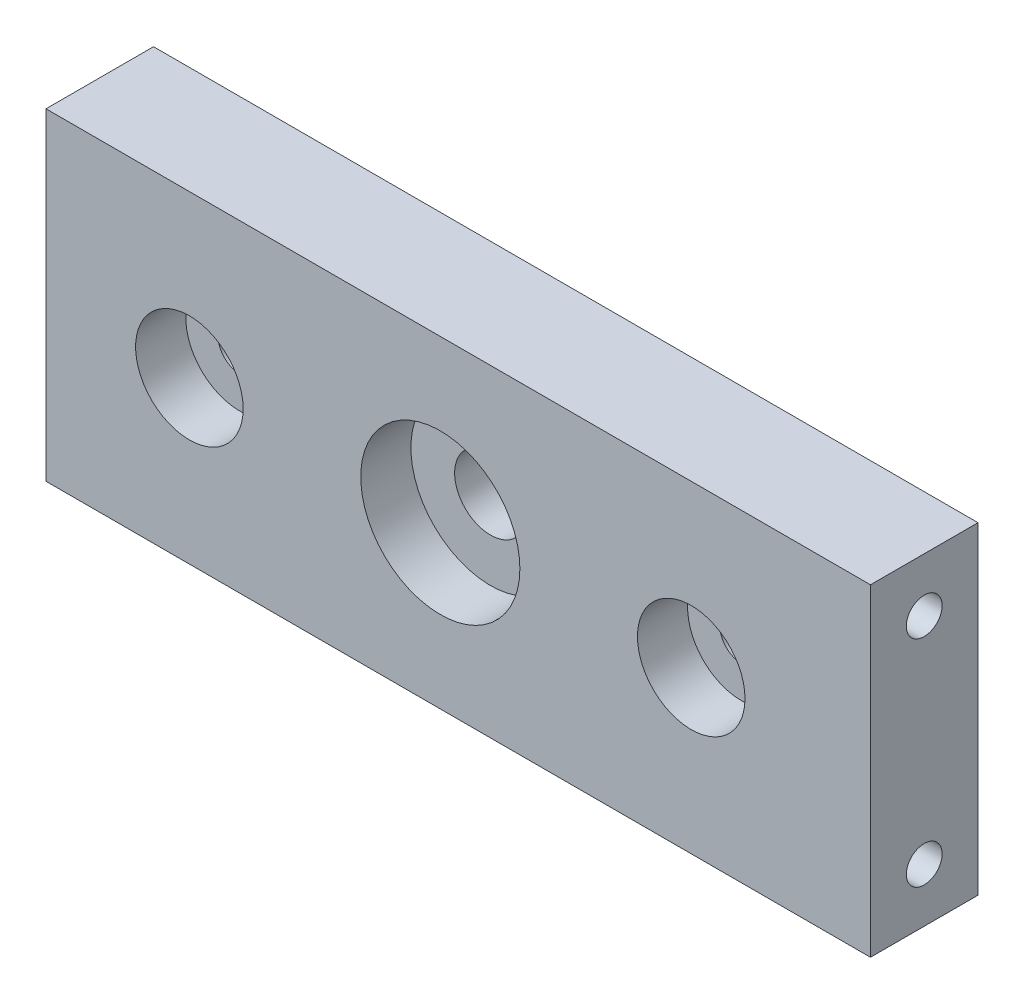
from build123d import *

# Parameters (mm, degrees)
SKETCH1_W           = 100
SKETCH1_H           = 45
SKETCH1_R           = 5
SKETCH1_R_2         = 3
BOSS_EXTRUDE1_DEPTH = 15
SKETCH2_R           = 7.5
SKETCH2_R_2         = 11.1
CUT_EXTRUDE1_DEPTH  = 7
SKETCH4_W           = 15
SKETCH4_H           = 45
BOSS_EXTRUDE2_DEPTH = 10
SKETCH5_R           = 5.5
CUT_EXTRUDE2_DEPTH  = 5
SKETCH7_R           = 2.5
CUT_EXTRUDE4_DEPTH  = 10
SKETCH10_R          = 2.5
CUT_EXTRUDE7_DEPTH  = 10
SKETCH11_W          = 15
SKETCH11_H          = 45
SKETCH11_R          = 2.5
BOSS_EXTRUDE3_DEPTH = 5


with BuildPart() as part:
    # Sketch1 → Boss-Extrude1 (new body)
    with BuildSketch(Plane.XY):
        Rectangle(SKETCH1_W, SKETCH1_H)
        Circle(SKETCH1_R, mode=Mode.SUBTRACT)
        with Locations((-35, 0)):
            Circle(SKETCH1_R_2, mode=Mode.SUBTRACT)
        with Locations((35, 0)):
            Circle(SKETCH1_R_2, mode=Mode.SUBTRACT)
    extrude(amount=BOSS_EXTRUDE1_DEPTH)

    # Sketch2 → Cut-Extrude1 (cut)
    with BuildSketch(Plane.XY.offset(15)):
        with Locations((-35, 0)):
            Circle(SKETCH2_R)
        with Locations((35, 0)):
            Circle(SKETCH2_R)
        Circle(SKETCH2_R_2)
    extrude(amount=-CUT_EXTRUDE1_DEPTH, mode=Mode.SUBTRACT)

    # Sketch4 → Boss-Extrude2 (add)
    with BuildSketch(Plane(origin=(50, 0, 0), x_dir=(0, 0, -1), z_dir=(1, 0, 0))):
        with Locations((-7.5, 0)):
            Rectangle(SKETCH4_W, SKETCH4_H)
    extrude(amount=BOSS_EXTRUDE2_DEPTH)

    # Sketch5 → Cut-Extrude2 (cut)
    with BuildSketch(Plane(origin=(0, 0, 0), x_dir=(-1, 0, 0), z_dir=(0, 0, -1))):
        with Locations((-35, 0)):
            Circle(SKETCH5_R)
        with Locations((35, 0)):
            Circle(SKETCH5_R)
    extrude(amount=-CUT_EXTRUDE2_DEPTH, mode=Mode.SUBTRACT)

    # Sketch7 → Cut-Extrude4 (cut, symmetric)
    with BuildSketch(Plane.ZY.offset(50)):
        with Locations((7.5, 15)):
            Circle(SKETCH7_R)
        with Locations((7.5, -15)):
            Circle(SKETCH7_R)
    cut_extrude4 = extrude(amount=CUT_EXTRUDE4_DEPTH, both=True, mode=Mode.SUBTRACT)

    # Sketch10 → Cut-Extrude7 (cut)
    with BuildSketch(Plane.XZ.offset(22.5)):
        with Locations((50, 7.5)):
            Circle(SKETCH10_R)
        with Locations((-20, 7.5)):
            Circle(SKETCH10_R)
    extrude(amount=-CUT_EXTRUDE7_DEPTH, mode=Mode.SUBTRACT)

    # Mirror1: Cut-Extrude4 across plane
    add(cut_extrude4.mirror(Plane(origin=(5, 0, 0), x_dir=(0, 0, 1), z_dir=(1, 0, 0))), mode=Mode.SUBTRACT)

    # Sketch11 → Boss-Extrude3 (add)
    with BuildSketch(Plane.ZY.offset(50)):
        with Locations((7.5, 0)):
            Rectangle(SKETCH11_W, SKETCH11_H)
        with Locations((7.5, 15)):
            Circle(SKETCH11_R, mode=Mode.SUBTRACT)
        with Locations((7.5, -15)):
            Circle(SKETCH11_R, mode=Mode.SUBTRACT)
    extrude(amount=BOSS_EXTRUDE3_DEPTH)


solid = part.part
